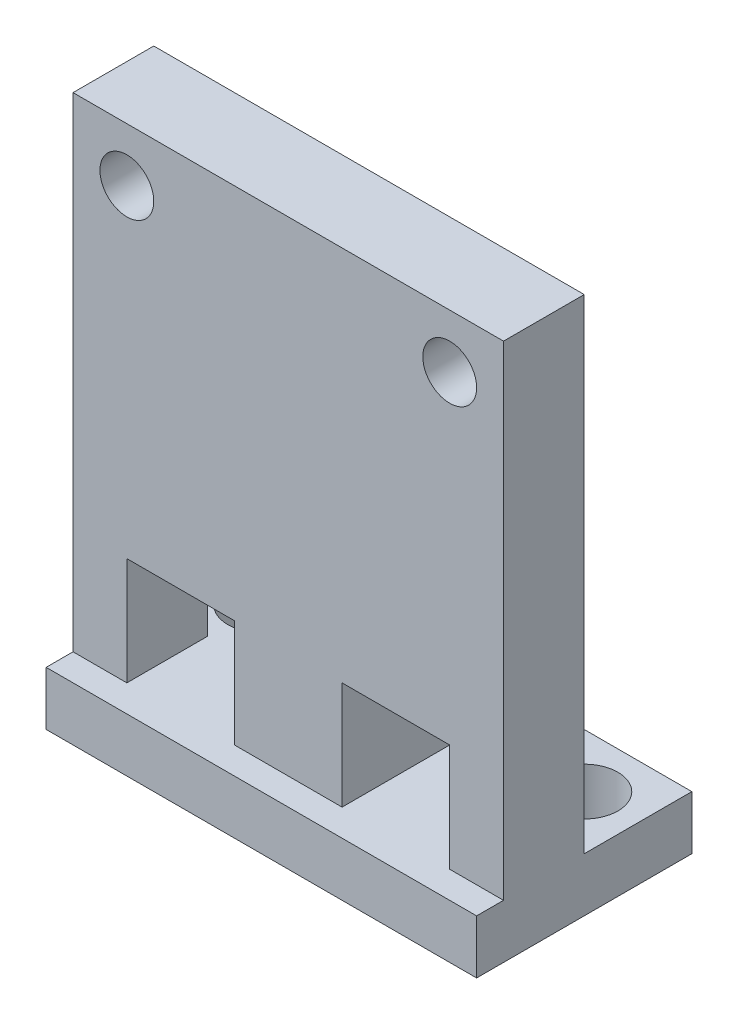
from build123d import *

# Parameters (mm, degrees)
SKETCH1_W           = 20.32
SKETCH1_H           = 25.4
BOSS_EXTRUDE1_DEPTH = 5.08
CUT_EXTRUDE1_REACH  = 34.922
SKETCH2_R           = 1.27
SKETCH3_W           = 20.32
SKETCH3_H           = 10.16
BOSS_EXTRUDE2_DEPTH = 2.54
SKETCH4_W           = 20.32
SKETCH4_H           = 22.86
CUT_EXTRUDE2_DEPTH  = 1.27
SKETCH5_R           = 1.5875
CUT_EXTRUDE3_DEPTH  = 2.54
SKETCH6_W           = 15.24
SKETCH6_H           = 5.08
CUT_EXTRUDE4_DEPTH  = 34.72083184
BOSS_EXTRUDE3_DEPTH = 2.54


with BuildPart() as part:
    # Sketch1 → Boss-Extrude1 (new body)
    with BuildSketch(Plane.XY):
        with Locations((10.16, 12.7)):
            Rectangle(SKETCH1_W, SKETCH1_H)
    extrude(amount=BOSS_EXTRUDE1_DEPTH)

    # Sketch2 → Cut-Extrude1 (cut, up to next)
    with BuildSketch(Plane.XY.offset(5.08), mode=Mode.PRIVATE) as cut_extrude1_sk1:
        with Locations((2.54, 22.86)):
            Circle(SKETCH2_R)
    cut_extrude1_tool1 = extrude(cut_extrude1_sk1.sketch, amount=-CUT_EXTRUDE1_REACH, mode=Mode.PRIVATE) & part.part
    # Sketch2 → Cut-Extrude1 (cut, up to next)
    with BuildSketch(Plane.XY.offset(5.08), mode=Mode.PRIVATE) as cut_extrude1_sk2:
        with Locations((17.78, 22.86)):
            Circle(SKETCH2_R)
    cut_extrude1_tool2 = extrude(cut_extrude1_sk2.sketch, amount=-CUT_EXTRUDE1_REACH, mode=Mode.PRIVATE) & part.part
    add(cut_extrude1_tool1.solids().sort_by_distance((2.54, 22.86, 5.08))[0], mode=Mode.SUBTRACT)
    add(cut_extrude1_tool2.solids().sort_by_distance((17.78, 22.86, 5.08))[0], mode=Mode.SUBTRACT)

    # Sketch3 → Boss-Extrude2 (add)
    with BuildSketch(Plane.XZ):
        with Locations((10.16, 0)):
            Rectangle(SKETCH3_W, SKETCH3_H)
    extrude(amount=-BOSS_EXTRUDE2_DEPTH)

    # Sketch4 → Cut-Extrude2 (cut)
    with BuildSketch(Plane.XY.offset(5.08)):
        with Locations((10.16, 13.97)):
            Rectangle(SKETCH4_W, SKETCH4_H)
    extrude(amount=-CUT_EXTRUDE2_DEPTH, mode=Mode.SUBTRACT)

    # Sketch5 → Cut-Extrude3 (cut)
    with BuildSketch(Plane(origin=(0, 2.54, 0), x_dir=(1, 0, 0), z_dir=(0, 1, 0))):
        with Locations((17.78, 2.54)):
            Circle(SKETCH5_R)
        with Locations((2.54, 2.54)):
            Circle(SKETCH5_R)
    extrude(amount=-CUT_EXTRUDE3_DEPTH, mode=Mode.SUBTRACT)

    # Sketch6 → Cut-Extrude4 (cut, through all)
    with BuildSketch(Plane.XY.offset(3.81)):
        with Locations((10.16, 5.08)):
            Rectangle(SKETCH6_W, SKETCH6_H)
    extrude(amount=-CUT_EXTRUDE4_DEPTH, mode=Mode.SUBTRACT)

    # Sketch7 → Boss-Extrude3 (add)
    with BuildSketch(Plane.ZY.offset(-10.16)):
        Polygon((0, 25.4), (-5.08, 2.54), (3.81, 2.54), (3.81, 25.4), align=None)
    boss_extrude3 = extrude(amount=BOSS_EXTRUDE3_DEPTH)

    # Mirror1: Boss-Extrude3 across plane
    add(boss_extrude3.mirror(Plane.ZY.offset(-10.16)))


solid = part.part
